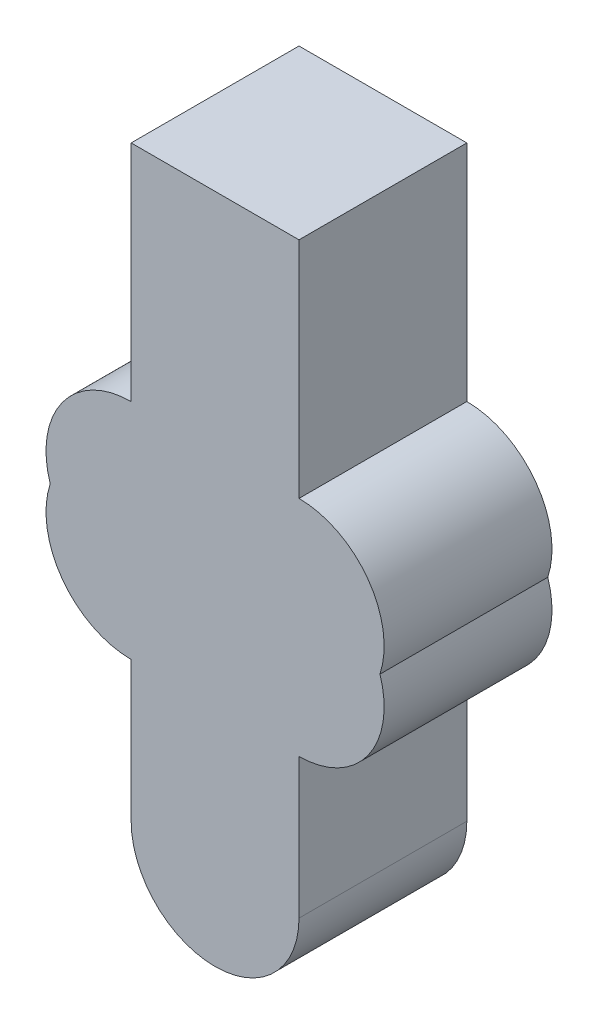
from build123d import *

# Parameters (mm, degrees)
SKETCH_6_W             = 6
SKETCH_6_H             = 21
EXTRUDE_2170_DEPTH     = 6
SKETCH_2219_W          = 10.3
SKETCH_2219_H          = 6.2
EXTRUDE_10_3_6_2_DEPTH = 6
SKETCH_1_R             = 3.05
EXTRUDE_6_1_DEPTH      = 6
SKETCH_2_R             = 3.05
EXTRUDE_6_2_DEPTH      = 6
SKETCH_3_R             = 3.05
EXTRUDE_6_3_DEPTH      = 6
SKETCH_4_R             = 3.05
EXTRUDE_6_4_DEPTH      = 6
SKETCH_2493_R          = 3
EXTRUDE_2498_DEPTH     = 6


with BuildPart() as part:
    # Канал_6 → Extrude 2170 (new body)
    with BuildSketch(Plane.XY):
        with Locations((0, -10.5)):
            Rectangle(SKETCH_6_W, SKETCH_6_H)
    extrude(amount=EXTRUDE_2170_DEPTH)

    # Sketch 2219 → Гайка_10_3х6_2 (add)
    with BuildSketch(Plane.XY):
        with Locations((0, -12)):
            Rectangle(SKETCH_2219_W, SKETCH_2219_H)
    extrude(amount=EXTRUDE_10_3_6_2_DEPTH)

    # Разгрузка_угла_1 → Угол_фреза6_1 (add)
    with BuildSketch(Plane.XY):
        with Locations((-2.993324317, -12.943324317)):
            Circle(SKETCH_1_R)
    extrude(amount=EXTRUDE_6_1_DEPTH)

    # Разгрузка_угла_2 → Угол_фреза6_2 (add)
    with BuildSketch(Plane.XY):
        with Locations((-2.993324317, -11.056675683)):
            Circle(SKETCH_2_R)
    extrude(amount=EXTRUDE_6_2_DEPTH)

    # Разгрузка_угла_3 → Угол_фреза6_3 (add)
    with BuildSketch(Plane.XY):
        with Locations((2.993324317, -12.943324317)):
            Circle(SKETCH_3_R)
    extrude(amount=EXTRUDE_6_3_DEPTH)

    # Разгрузка_угла_4 → Угол_фреза6_4 (add)
    with BuildSketch(Plane.XY):
        with Locations((2.993324317, -11.056675683)):
            Circle(SKETCH_4_R)
    extrude(amount=EXTRUDE_6_4_DEPTH)

    # Sketch 2493 → Extrude 2498 (add)
    with BuildSketch(Plane.XY):
        with Locations((0, -21)):
            Circle(SKETCH_2493_R)
    extrude(amount=EXTRUDE_2498_DEPTH)


solid = part.part
